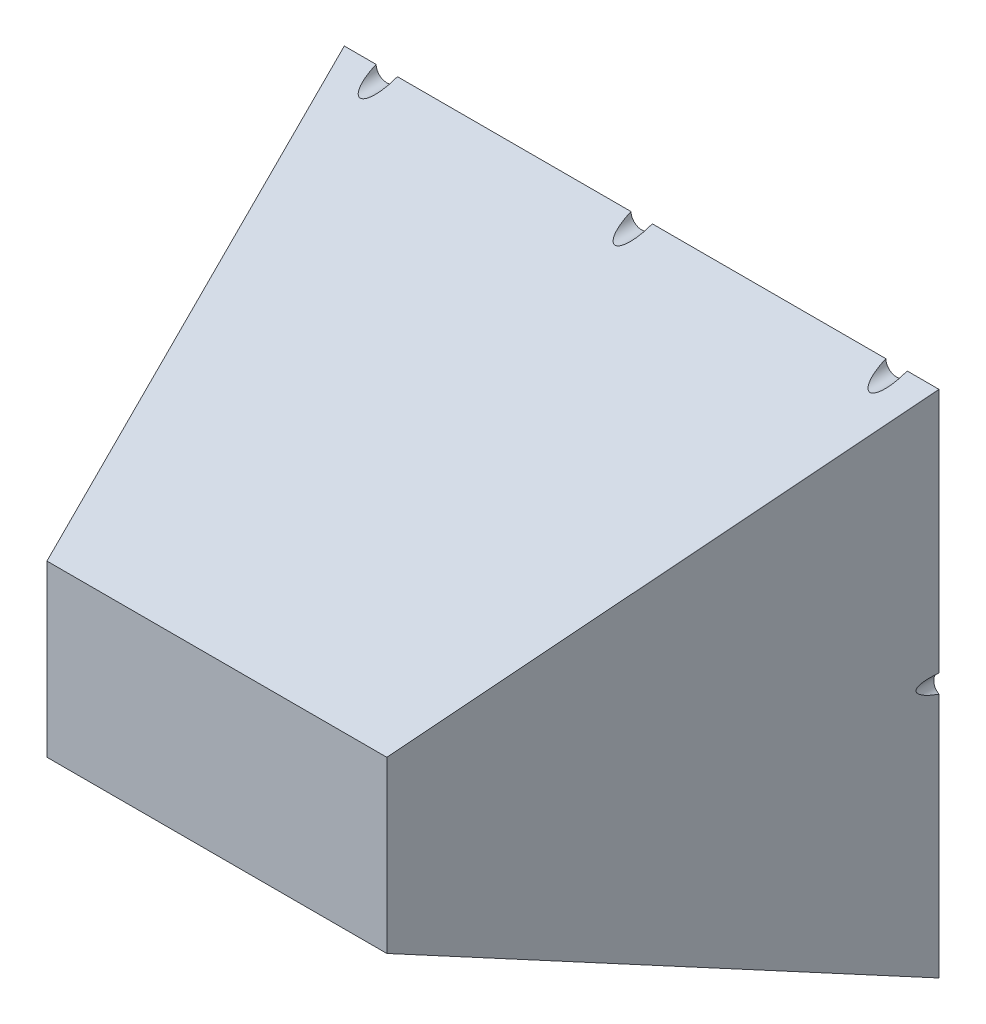
from build123d import *
from OCP.BRepFilletAPI import BRepFilletAPI_MakeChamfer

# Parameters (mm, degrees)
SKETCH1_W           = 355.6
SKETCH1_H           = 304.8
BOSS_EXTRUDE1_DEPTH = 254
CHAMFER1_SIZE       = 254
CHAMFER1_SIZE_2     = 101.6
CHAMFER2_SIZE       = 254
CHAMFER2_SIZE_2     = 76.2
SKETCH2_R           = 6.35
CUT_EXTRUDE1_DEPTH  = 346.477350922


with BuildPart() as part:
    # Sketch1 → Boss-Extrude1 (new body)
    with BuildSketch(Plane.XY):
        Rectangle(SKETCH1_W, SKETCH1_H)
    extrude(amount=BOSS_EXTRUDE1_DEPTH)

    # Chamfer1
    chamfer1_edges_1 = [part.edges().sort_by_distance(p)[0] for p in [
        (0, -152.4, 254),
    ]]
    chamfer1_side_1 = [part.faces().sort_by_distance(p)[0] for p in [
        (0, -152.4, 251.968),
    ]]
    chamfer1_edges_2 = [part.edges().sort_by_distance(p)[0] for p in [
        (0, 152.4, 254),
    ]]
    chamfer1_side_2 = [part.faces().sort_by_distance(p)[0] for p in [
        (0, 152.4, 251.968),
    ]]
    chamfer1 = BRepFilletAPI_MakeChamfer(part.part.solid().wrapped)
    for e in chamfer1_edges_1:
        chamfer1.Add(CHAMFER1_SIZE - 0.0001, CHAMFER1_SIZE_2 - 0.0001, e.wrapped, chamfer1_side_1[0].wrapped)
    for e in chamfer1_edges_2:
        chamfer1.Add(CHAMFER1_SIZE - 0.0001, CHAMFER1_SIZE_2 - 0.0001, e.wrapped, chamfer1_side_2[0].wrapped)
    add(Compound.cast(chamfer1.Shape()), mode=Mode.REPLACE)  # a hair under: the kernel refuses the full size

    # Chamfer2
    chamfer2_edges_1 = [part.edges().sort_by_distance(p)[0] for p in [
        (177.8, 0, 254),
    ]]
    chamfer2_side_1 = [part.faces().sort_by_distance(p)[0] for p in [
        (177.8, 0, 252.476),
    ]]
    chamfer2_edges_2 = [part.edges().sort_by_distance(p)[0] for p in [
        (-177.8, 0, 254),
    ]]
    chamfer2_side_2 = [part.faces().sort_by_distance(p)[0] for p in [
        (-177.8, 0, 252.476),
    ]]
    chamfer2 = BRepFilletAPI_MakeChamfer(part.part.solid().wrapped)
    for e in chamfer2_edges_1:
        chamfer2.Add(CHAMFER2_SIZE - 0.0001, CHAMFER2_SIZE_2 - 0.0001, e.wrapped, chamfer2_side_1[0].wrapped)
    for e in chamfer2_edges_2:
        chamfer2.Add(CHAMFER2_SIZE - 0.0001, CHAMFER2_SIZE_2 - 0.0001, e.wrapped, chamfer2_side_2[0].wrapped)
    add(Compound.cast(chamfer2.Shape()), mode=Mode.REPLACE)  # a hair under: the kernel refuses the full size

    # Sketch2 → Cut-Extrude1 (cut, through all)
    with BuildSketch(Plane.XY):
        with Locations((-180.975, 0)):
            Circle(SKETCH2_R)
        with Locations((0, 152.4)):
            Circle(SKETCH2_R)
        with Locations((152.4, 152.4)):
            Circle(SKETCH2_R)
        with Locations((-152.4, 152.4)):
            Circle(SKETCH2_R)
        with Locations((180.975, 0)):
            Circle(SKETCH2_R)
        with Locations((152.4, -152.4)):
            Circle(SKETCH2_R)
        with Locations((0, -152.4)):
            Circle(SKETCH2_R)
        with Locations((-152.4, -152.4)):
            Circle(SKETCH2_R)
    extrude(amount=CUT_EXTRUDE1_DEPTH, mode=Mode.SUBTRACT)


solid = part.part
